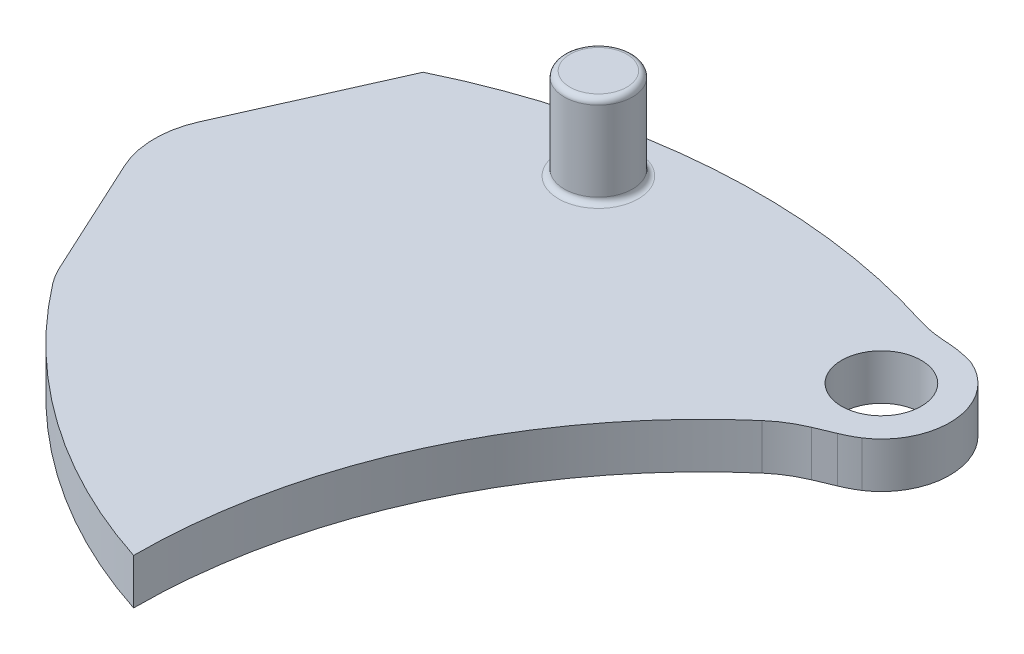
from build123d import *

# Parameters (mm, degrees)
BOSS_EXTRUDE1_DEPTH = 2
FILLET1_R           = 2.5
SKETCH2_R           = 1.5
SKETCH2_R_2         = 1.75
CUT_EXTRUDE1_DEPTH  = 2
CUT_EXTRUDE2_REACH  = 34.399
BOSS_EXTRUDE2_START = -2
SKETCH6_R           = 1.5
BOSS_EXTRUDE2_DEPTH = 2
BOSS_EXTRUDE3_START = -2
BOSS_EXTRUDE3_DEPTH = 2
FILLET2_START       = -1
FILLET2_DEPTH       = 4
FILLET2_2_DEPTH     = 2
CUT_EXTRUDE3_DEPTH  = 2
FILLET3_R           = 4
SKETCH11_R          = 1.5
BOSS_EXTRUDE4_DEPTH = 4
FILLET6_R           = 0.25


with BuildPart() as part:
    # Sketch1 → Boss-Extrude1 (new body)
    with BuildSketch(Plane(origin=(0, 0, 0), x_dir=(1, 0, 0), z_dir=(0, 1, 0))):
        with BuildLine():
            ThreePointArc((15.125, 22.967027997), (-1.263298306, 27.470967901), (-17.169059596, 21.48193177))
            ThreePointArc((-17.169059596, 21.48193177), (-11.803604023, 8.168176911), (0, 0))
            ThreePointArc((0, 0), (4.120883639, 13.75), (15.125, 22.967027997))
        make_face()
    extrude(amount=BOSS_EXTRUDE1_DEPTH)

    # Fillet1
    fillet1_edges = [part.edges().sort_by_distance(p)[0] for p in [
        (-17.169059596, 1, -21.48193177),
        (15.125, 1, -22.967027997),
    ]]
    fillet(fillet1_edges, radius=FILLET1_R)

    # Sketch2 → Cut-Extrude1 (cut)
    with BuildSketch(Plane(origin=(0, 2, 0), x_dir=(1, 0, 0), z_dir=(0, 1, 0))):
        with Locations(Location((-4.226868107, 24.640080885, 0), (0, 0, 270))):
            Circle(SKETCH2_R)
        with Locations(Location((9.875, 22.967027997, 0), (0, 0, 270))):
            Circle(SKETCH2_R_2)
    extrude(amount=-CUT_EXTRUDE1_DEPTH, mode=Mode.SUBTRACT)

    # Sketch3 → Cut-Extrude2 (cut, up to next)
    with BuildSketch(Plane(origin=(0, 2, 0), x_dir=(1, 0, 0), z_dir=(0, 1, 0)), mode=Mode.PRIVATE) as cut_extrude2_sk1:
        with BuildLine():
            Line((-15.980917027, 15.838569726), (-12.020745702, 24.733614228))
            ThreePointArc((-12.020745702, 24.733614228), (-14.04148027, 23.645017061), (-15.964394934, 22.391696997))
            ThreePointArc((-15.964394934, 22.391696997), (-16.816313344, 21.328273965), (-16.984031989, 19.976052098))
            ThreePointArc((-16.984031989, 19.976052098), (-16.570708205, 17.885919028), (-15.980917027, 15.838569726))
        make_face()
    cut_extrude2_tool1 = extrude(cut_extrude2_sk1.sketch, amount=-CUT_EXTRUDE2_REACH, mode=Mode.PRIVATE) & part.part
    add(cut_extrude2_tool1.solids().sort_by_distance((-15.061244, 2, -20.693622))[0], mode=Mode.SUBTRACT)

    # Sketch6 → Boss-Extrude2 (add)
    with BuildSketch(Plane.XZ.offset(BOSS_EXTRUDE2_START)):
        with Locations((-4.226868107, -24.640080885)):
            Circle(SKETCH6_R)
    extrude(amount=BOSS_EXTRUDE2_DEPTH)

    # Sketch7 → Boss-Extrude3 (add)
    with BuildSketch(Plane(origin=(0, 2, 0), x_dir=(1, 0, 0), z_dir=(0, 1, 0)).offset(BOSS_EXTRUDE3_START)):
        with BuildLine():
            Line((9.313984882, 19.466610638), (11.248778971, 20.27693074))
            ThreePointArc((11.248778971, 20.27693074), (11.386576571, 20.3697006), (11.525, 20.461534033))
            ThreePointArc((11.525, 20.461534033), (12.863352389, 23.23113025), (11.06, 25.723071356))
            ThreePointArc((11.06, 25.723071356), (10.846265511, 25.813921137), (10.631784841, 25.902995022))
            Line((10.631784841, 25.902995022), (8.903638019, 26.018747665))
            ThreePointArc((8.903638019, 26.018747665), (9.890276319, 25.659938315), (10.8625, 25.263730796))
            ThreePointArc((10.8625, 25.263730796), (12.365293657, 23.187113207), (11.25, 20.879116361))
            ThreePointArc((11.25, 20.879116361), (10.26505719, 20.196075371), (9.313984882, 19.466610638))
        make_face()
    extrude(amount=BOSS_EXTRUDE3_DEPTH)

    # Fillet2: read off the stored shape, not the designer's step
    # Fillet2 outline → Fillet2 (cut)
    with BuildSketch(Plane(origin=(0, 0, 0), x_dir=(1, 0, 0), z_dir=(0, 1, 0)).offset(FILLET2_START)):
        with BuildLine():
            ThreePointArc((11.525, 20.461534033), (11.178047435, 20.264564275), (10.816495082, 20.095883915))
            Line((10.816495082, 20.095883915), (11.248778971, 20.27693074))
            ThreePointArc((11.248778971, 20.27693074), (11.386576571, 20.3697006), (11.525, 20.461534033))
        make_face()
        with BuildLine():
            Line((10.631784841, 25.902995022), (9.853687309, 25.955112611))
            ThreePointArc((9.853687309, 25.955112611), (10.463996888, 25.876279494), (11.06, 25.723071356))
            ThreePointArc((11.06, 25.723071356), (10.846265511, 25.813921137), (10.631784841, 25.902995022))
        make_face()
    extrude(amount=FILLET2_DEPTH, mode=Mode.SUBTRACT)

    # Fillet2 2 outline → Fillet2 2 (add)
    with BuildSketch(Plane(origin=(0, 0, 0), x_dir=(1, 0, 0), z_dir=(0, 1, 0))):
        with BuildLine():
            ThreePointArc((9.313984882, 19.466610638), (8.990075455, 19.201101949), (8.670659365, 18.930204289))
            ThreePointArc((8.670659365, 18.930204289), (9.30523679, 19.395787738), (10.005013016, 19.756023341))
            Line((10.005013016, 19.756023341), (9.313984882, 19.466610638))
        make_face()
        with BuildLine():
            Line((8.903638019, 26.018747665), (9.535077314, 25.97645336))
            ThreePointArc((9.535077314, 25.97645336), (8.936180246, 26.053104962), (8.350889065, 26.201386448))
            ThreePointArc((8.350889065, 26.201386448), (8.627746835, 26.111529725), (8.903638019, 26.018747665))
        make_face()
    extrude(amount=FILLET2_2_DEPTH)

    # Sketch8 → Cut-Extrude3 (cut)
    with BuildSketch(Plane(origin=(0, 2, 0), x_dir=(1, 0, 0), z_dir=(0, 1, 0))):
        Polygon((-17.225521171, 19.396093794), (-10.650323335, 5.173654997), (-21.381773126, 15.240189751), align=None)
    extrude(amount=-CUT_EXTRUDE3_DEPTH, mode=Mode.SUBTRACT)

    # Fillet3
    fillet3_edges = [part.edges().sort_by_distance(p)[0] for p in [
        (-15.784646242, 1, -16.279418676),
        (-12.383702581, 1, -8.923029671),
    ]]
    fillet(fillet3_edges, radius=FILLET3_R)

    # Sketch11 → Boss-Extrude4 (add)
    with BuildSketch(Plane(origin=(0, 2, 0), x_dir=(1, 0, 0), z_dir=(0, 1, 0))):
        with Locations(Location((-4.226868107, 24.640080885, 0), (0, 0, 270))):
            Circle(SKETCH11_R)
    extrude(amount=BOSS_EXTRUDE4_DEPTH)

    # Fillet6
    fillet6_edges = [part.edges().sort_by_distance(p)[0] for p in [
        (-4.226868107, 2, -26.140080885),
        (-4.226868107, 6, -26.140080885),
    ]]
    fillet(fillet6_edges, radius=FILLET6_R)


solid = part.part
